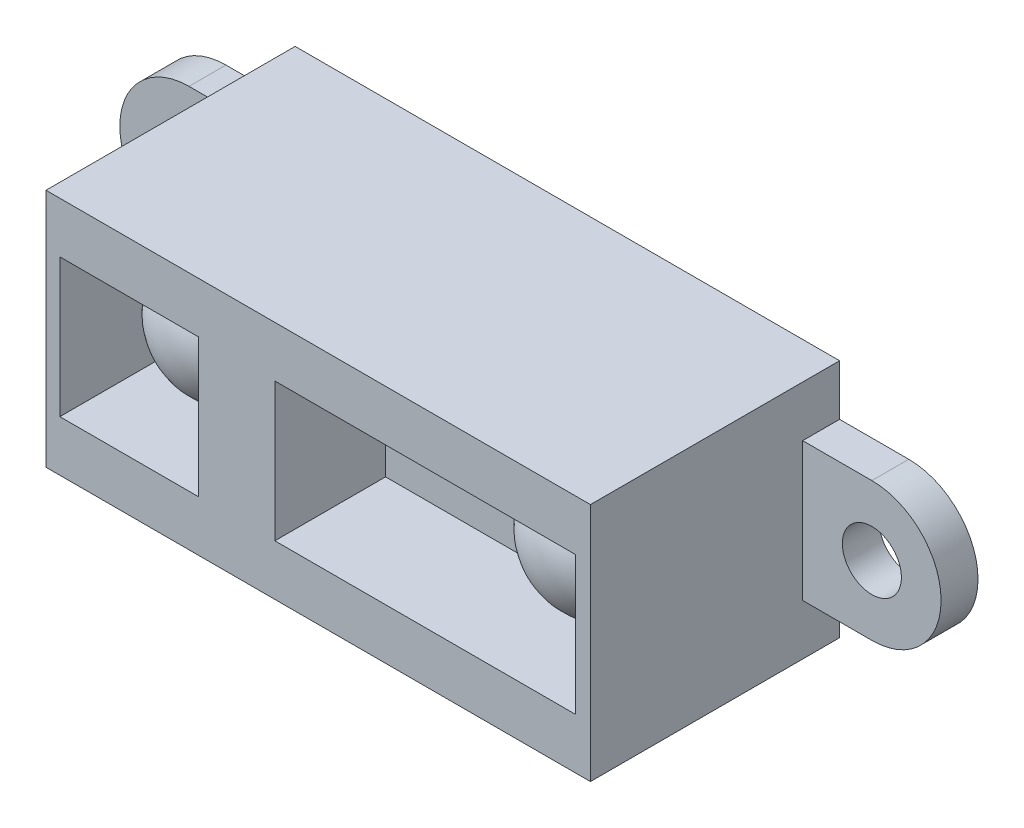
from build123d import *
from build123d.topology import SkipClean

# Parameters (mm, degrees)
SKETCH_1_W          = 29.5
SKETCH_1_H          = 13
EXTRUDE_1_DEPTH     = 13.5
SKETCH_2_R          = 1.6
EXTRUDE_2_DEPTH     = 2
SKETCH_3_W          = 7.5
SKETCH_3_H          = 7.5
SKETCH_3_W_2        = 16.3
CUT_EXTRUDE_1_DEPTH = 6
SKETCH_7_W          = 10.1
SKETCH_7_H          = 3.3
EXTRUDE_3_DEPTH     = 6


with BuildPart() as part:
    # 스케치1 → 보스-돌출1 (new body)
    with BuildSketch(Plane.XY):
        Rectangle(SKETCH_1_W, SKETCH_1_H)
    extrude(amount=EXTRUDE_1_DEPTH)

    # 스케치2 → 보스-돌출2 (add)
    with BuildSketch(Plane(origin=(0, 0, 0), x_dir=(-1, 0, 0), z_dir=(0, 0, -1))):
        with BuildLine():
            Line((-18.5, -3.75), (18.5, -3.75))
            ThreePointArc((18.5, -3.75), (22.25, 0), (18.5, 3.75))
            Line((18.5, 3.75), (-18.5, 3.75))
            ThreePointArc((-18.5, 3.75), (-22.25, 0), (-18.5, -3.75))
        make_face()
        with Locations((-18.5, 0)):
            Circle(SKETCH_2_R, mode=Mode.SUBTRACT)
        with Locations((18.5, 0)):
            Circle(SKETCH_2_R, mode=Mode.SUBTRACT)
    extrude(amount=-EXTRUDE_2_DEPTH)

    # 스케치3 → 컷-돌출1 (cut)
    with BuildSketch(Plane.XY.offset(13.5)):
        with Locations((-10.25, 0)):
            Rectangle(SKETCH_3_W, SKETCH_3_H)
        with Locations((5.8, 0)):
            Rectangle(SKETCH_3_W_2, SKETCH_3_H)
    extrude(amount=-CUT_EXTRUDE_1_DEPTH, mode=Mode.SUBTRACT)

    # 스케치4 → 회전1 (revolve)
    with BuildSketch(Plane.XY.offset(7.5)):
        with BuildLine():
            Line((-10.25, -3.75), (-10.25, 3.75))
            ThreePointArc((-10.25, 3.75), (-14, 0), (-10.25, -3.75))
        make_face()
    revolve(axis=Axis((-10.25, 3.75, 7.5), (0, -1, 0)))

    # 스케치6 → 회전14 (revolve)
    with SkipClean():  # the faces are left unmerged after this step: merging them gives an invalid solid
        with BuildSketch(Plane.XY.offset(7.5)):
            with BuildLine():
                Line((9.902834279, 3.75), (9.902834279, -3.75))
                ThreePointArc((9.902834279, -3.75), (12.554484709, -2.651650429), (13.652834279, 0))
                ThreePointArc((13.652834279, 0), (12.554484709, 2.651650429), (9.902834279, 3.75))
            make_face()
        revolve(axis=Axis((9.902834279, -3.75, 7.5), (0, 1, 0)))

    # 스케치7 → 보스-돌출3 (add)
    with SkipClean():  # the faces are left unmerged after this step: merging them gives an invalid solid
        with BuildSketch(Plane.XZ.offset(6.5)):
            with Locations((1, 1.65)):
                Rectangle(SKETCH_7_W, SKETCH_7_H)
        extrude(amount=EXTRUDE_3_DEPTH)


solid = part.part
